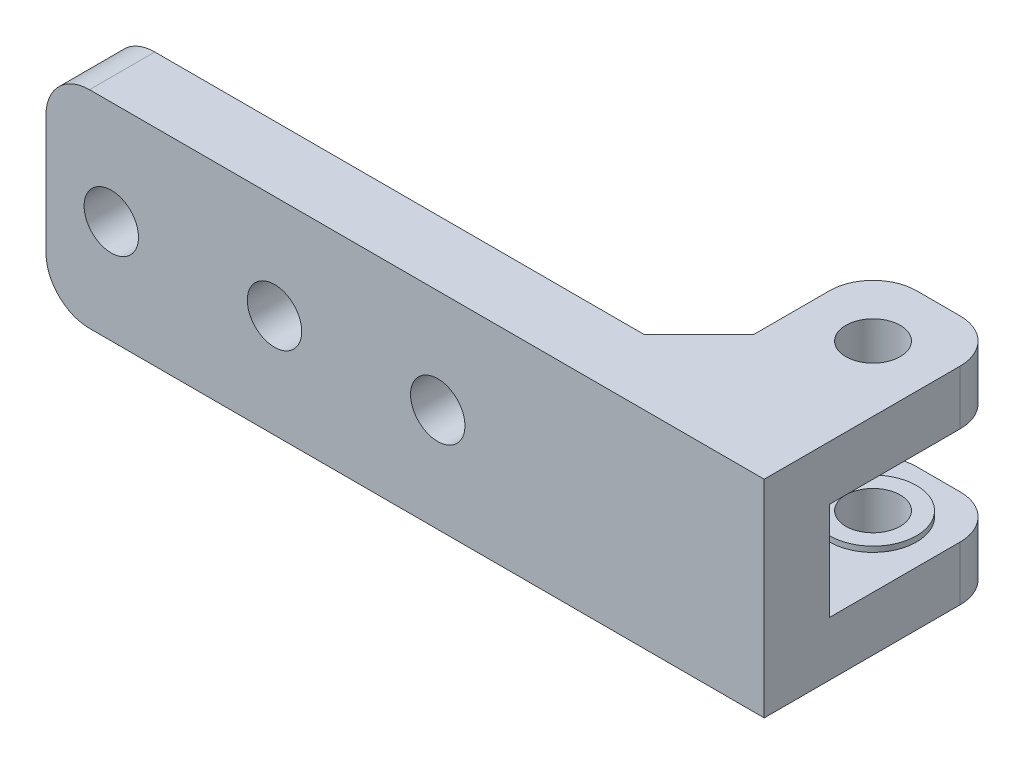
from build123d import *

# Parameters (mm, degrees)
EXTRUDE_1_DEPTH     = 12
SKETCH_2_R          = 2.5
CUT_EXTRUDE_1_DEPTH = 32.448370387
SKETCH_3_R          = 4
SKETCH_3_R_2        = 2.5
EXTRUDE_2_DEPTH     = 0.5
EXTRUDE_START       = 0.5
SKETCH_4_R          = 4
SKETCH_4_R_2        = 2.5
EXTRUDE_3_DEPTH     = 0.5
FILLET_1_R          = 4
EXTRUDE_START_2     = -6
SKETCH_5_W          = 54
SKETCH_5_H          = 19
EXTRUDE_4_DEPTH     = 6
CHAMFER_1_SIZE      = 5
SKETCH_6_R          = 2.5
CUT_EXTRUDE_2_DEPTH = 60.439044407
FILLET_2_R          = 4


with BuildPart() as part:
    # Эскиз1 → Бобышка-Вытянуть1 (new body)
    with BuildSketch(Plane(origin=(0, 0, 0), x_dir=(0, 0, -1), z_dir=(1, 0, 0))):
        Polygon((0, 0), (22, 0), (22, 5), (6, 5), (6, 14), (22, 14), (22, 19), (0, 19), align=None)
    extrude(amount=EXTRUDE_1_DEPTH)

    # Эскиз2 → Вырез-Вытянуть1 (cut, through all)
    with BuildSketch(Plane(origin=(0, 19, 0), x_dir=(1, 0, 0), z_dir=(0, 1, 0))):
        with Locations(Location((6, 16, 0), (0, 0, 270))):
            Circle(SKETCH_2_R)
    extrude(amount=-CUT_EXTRUDE_1_DEPTH, mode=Mode.SUBTRACT)

    # Эскиз3 → Бобышка-Вытянуть2 (add)
    with BuildSketch(Plane.XZ.offset(-14)):
        with Locations(Location((6, -16, 0), (0, 0, 90))):
            Circle(SKETCH_3_R)
        with Locations(Location((6, -16, 0), (0, 0, 90))):
            Circle(SKETCH_3_R_2, mode=Mode.SUBTRACT)
    extrude(amount=EXTRUDE_2_DEPTH)

    # Эскиз4 → Бобышка-Вытянуть3 (add)
    with BuildSketch(Plane(origin=(0, 5, 0), x_dir=(1, 0, 0), z_dir=(0, 1, 0)).offset(EXTRUDE_START)):
        with Locations(Location((6, 16, 0), (0, 0, 270))):
            Circle(SKETCH_4_R)
        with Locations(Location((6, 16, 0), (0, 0, 270))):
            Circle(SKETCH_4_R_2, mode=Mode.SUBTRACT)
    extrude(amount=-EXTRUDE_3_DEPTH)

    # Скругление1
    fillet_1_edges = [part.edges().sort_by_distance(p)[0] for p in [
        (12, 2.5, -22),
        (12, 16.5, -22),
        (0, 16.5, -22),
        (0, 2.5, -22),
    ]]
    fillet(fillet_1_edges, radius=FILLET_1_R)

    # Эскиз5 → Бобышка-Вытянуть4 (add)
    with BuildSketch(Plane.XY.offset(EXTRUDE_START_2)):
        with Locations((-27, 9.5)):
            Rectangle(SKETCH_5_W, SKETCH_5_H)
    extrude(amount=EXTRUDE_4_DEPTH)

    # Фаска1
    chamfer_1_edges = [part.edges().sort_by_distance(p)[0] for p in [
        (0, 16.5, -6),
        (0, 2.5, -6),
    ]]
    chamfer(chamfer_1_edges, length=CHAMFER_1_SIZE)

    # Эскиз6 → Вырез-Вытянуть2 (cut, through all)
    with BuildSketch(Plane(origin=(0, 0, -6), x_dir=(-1, 0, 0), z_dir=(0, 0, -1))):
        with Locations((48, 9.5)):
            Circle(SKETCH_6_R)
        with Locations((33, 9.5)):
            Circle(SKETCH_6_R)
        with Locations((18, 9.5)):
            Circle(SKETCH_6_R)
    extrude(amount=-CUT_EXTRUDE_2_DEPTH, mode=Mode.SUBTRACT)

    # Скругление2
    fillet_2_edges = [part.edges().sort_by_distance(p)[0] for p in [
        (-54, 0, -3),
        (-54, 19, -3),
    ]]
    fillet(fillet_2_edges, radius=FILLET_2_R)


solid = part.part
